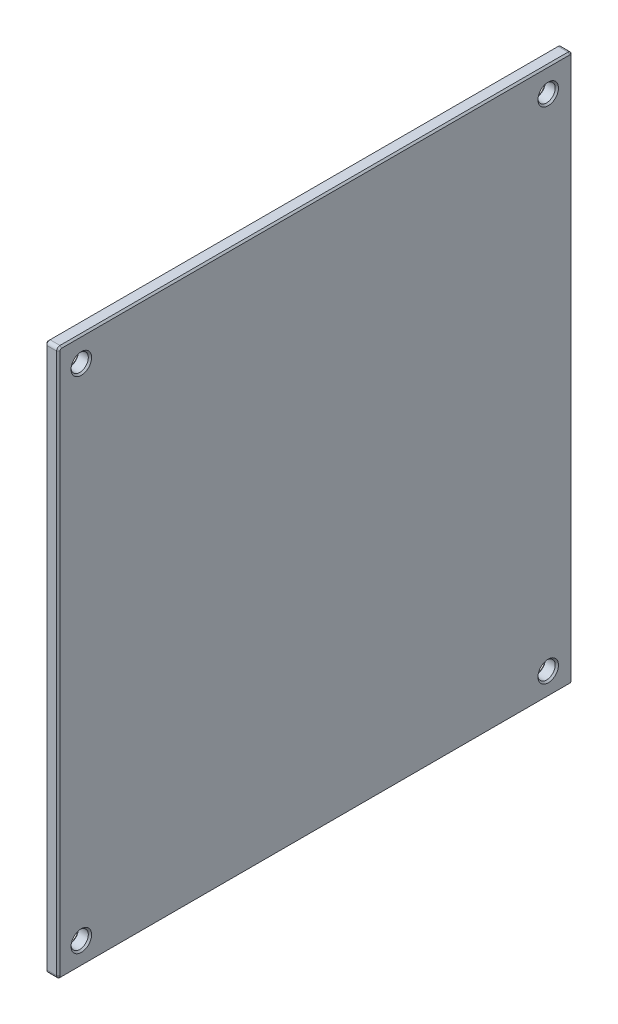
from build123d import *

# Parameters (mm, degrees)
SKETCH_1_W          = 65.8
SKETCH_1_H          = 69.8
EXTRUDE_1_DEPTH     = 1.6
SKETCH_2_R          = 1.05
CUT_EXTRUDE_1_DEPTH = 1.6
SKETCH_5_W          = 65.8
SKETCH_5_H          = 69.8
SKETCH_5_W_2        = 62.6
SKETCH_5_H_2        = 66.6
CUT_EXTRUDE_2_DEPTH = 1.6
FILLET_2_R          = 0.4
CHAMFER_1_SIZE      = 0.2


with BuildPart() as part:
    # 草图1 → 凸台-拉伸1 (new body)
    with BuildSketch(Plane(origin=(0, 0, 0), x_dir=(0, 0, -1), z_dir=(1, 0, 0))):
        with Locations((32.9, -34.9)):
            Rectangle(SKETCH_1_W, SKETCH_1_H)
    extrude(amount=EXTRUDE_1_DEPTH)

    # 草图2 → 切除-拉伸1 (cut)
    with BuildSketch(Plane(origin=(1.6, 0, 0), x_dir=(0, 0, -1), z_dir=(1, 0, 0))):
        with Locations((61.2, -4.6)):
            Circle(SKETCH_2_R)
        with Locations((4.4, -4.6)):
            Circle(SKETCH_2_R)
        with Locations((4.4, -65.4)):
            Circle(SKETCH_2_R)
        with Locations((61.2, -65.4)):
            Circle(SKETCH_2_R)
    extrude(amount=-CUT_EXTRUDE_1_DEPTH, mode=Mode.SUBTRACT)

    # 草图5 → 切除-拉伸2 (cut)
    with BuildSketch(Plane.ZY):
        with Locations((-32.9, -34.9)):
            Rectangle(SKETCH_5_W, SKETCH_5_H)
        with Locations((-32.9, -34.9)):
            Rectangle(SKETCH_5_W_2, SKETCH_5_H_2, mode=Mode.SUBTRACT)
    extrude(amount=-CUT_EXTRUDE_2_DEPTH, mode=Mode.SUBTRACT)

    # 圆角2
    fillet_2_edges = [part.edges().sort_by_distance(p)[0] for p in [
        (0.8, -1.6, -1.6),
        (0.8, -68.2, -1.6),
        (0.8, -68.2, -64.2),
        (0.8, -1.6, -64.2),
    ]]
    fillet(fillet_2_edges, radius=FILLET_2_R)

    # 倒角1
    chamfer_1_edges = [part.edges().sort_by_distance(p)[0] for p in [
        (0, -4.6, -60.15),
        (0, -4.6, -3.35),
        (0, -65.4, -3.35),
        (0, -65.4, -60.15),
        (1.6, -4.6, -60.15),
        (1.6, -4.6, -3.35),
        (1.6, -65.4, -3.35),
        (1.6, -65.4, -60.15),
        (0, -34.9, -1.6),
        (0, -68.2, -32.9),
        (0, -34.9, -64.2),
        (0, -1.6, -32.9),
        (1.6, -68.2, -32.9),
        (1.6, -34.9, -1.6),
        (1.6, -1.6, -32.9),
        (1.6, -34.9, -64.2),
        (0, -68.082842712, -1.717157288),
        (0, -68.082842712, -64.082842712),
        (0, -1.717157288, -64.082842712),
        (0, -1.717157288, -1.717157288),
        (1.6, -1.717157288, -64.082842712),
        (1.6, -68.082842712, -64.082842712),
        (1.6, -68.082842712, -1.717157288),
        (1.6, -1.717157288, -1.717157288),
    ]]
    chamfer(chamfer_1_edges, length=CHAMFER_1_SIZE)


solid = part.part
